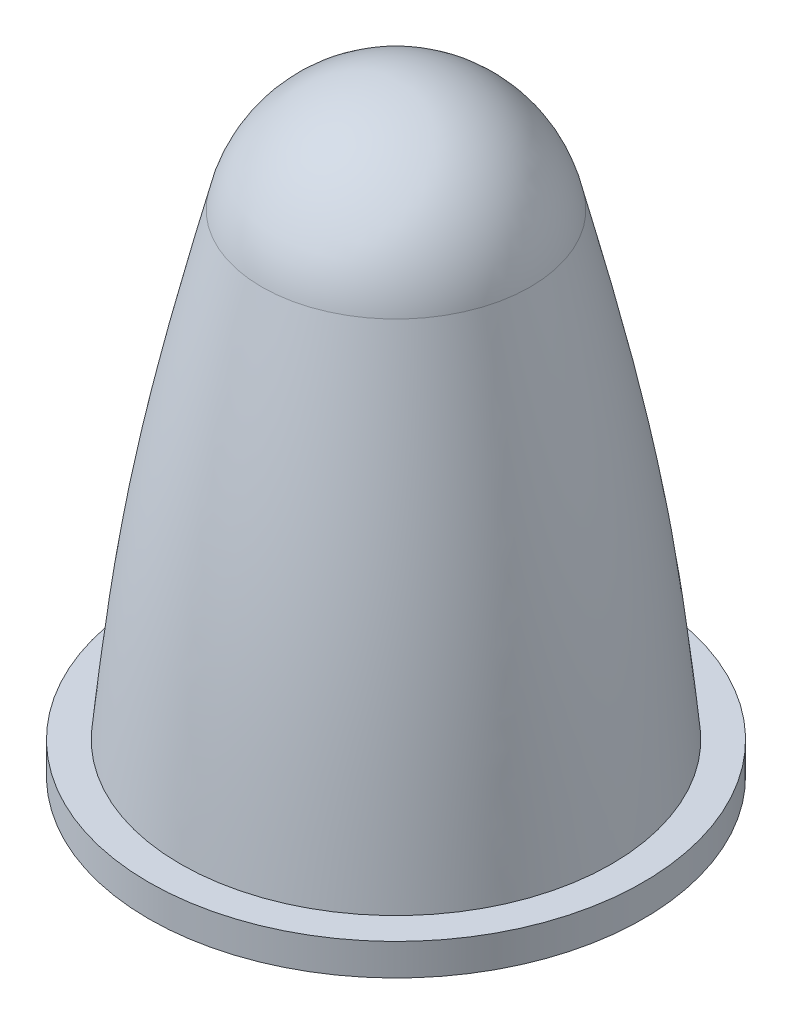
from build123d import *

# Parameters (mm, degrees)
SKETCH3_R           = 7.805880548
BOSS_EXTRUDE1_DEPTH = 1
SKETCH5_R           = 3
CUT_EXTRUDE1_DEPTH  = 10


with BuildPart() as part:
    # Sketch1 → Revolve1 (revolve)
    with BuildSketch(Plane.XY):
        with BuildLine():
            Line((0, 0), (-6.805880548, 0))
            add(Edge.make_bspline(
                [(-6.805880548, 0), (-6.310522262, 4.999742109), (-5.931704619, 7.785319031), (-4.241672522, 14.5)],
                knots=[0, 0, 0, 0, 1, 1, 1, 1], degree=3))
            ThreePointArc((-4.241672522, 14.5), (-2.749626601, 17.012035059), (0, 18))
            Line((0, 18), (0, 0))
        make_face()
    revolve(axis=Axis((0, 18, 0), (0, -1, 0)))

    # Sketch3 → Boss-Extrude1 (add)
    with BuildSketch(Plane.XZ):
        Circle(SKETCH3_R)
    extrude(amount=BOSS_EXTRUDE1_DEPTH)

    # Sketch5 → Cut-Extrude1 (cut)
    with BuildSketch(Plane.XZ.offset(1)):
        Circle(SKETCH5_R)
    extrude(amount=-CUT_EXTRUDE1_DEPTH, mode=Mode.SUBTRACT)


solid = part.part
